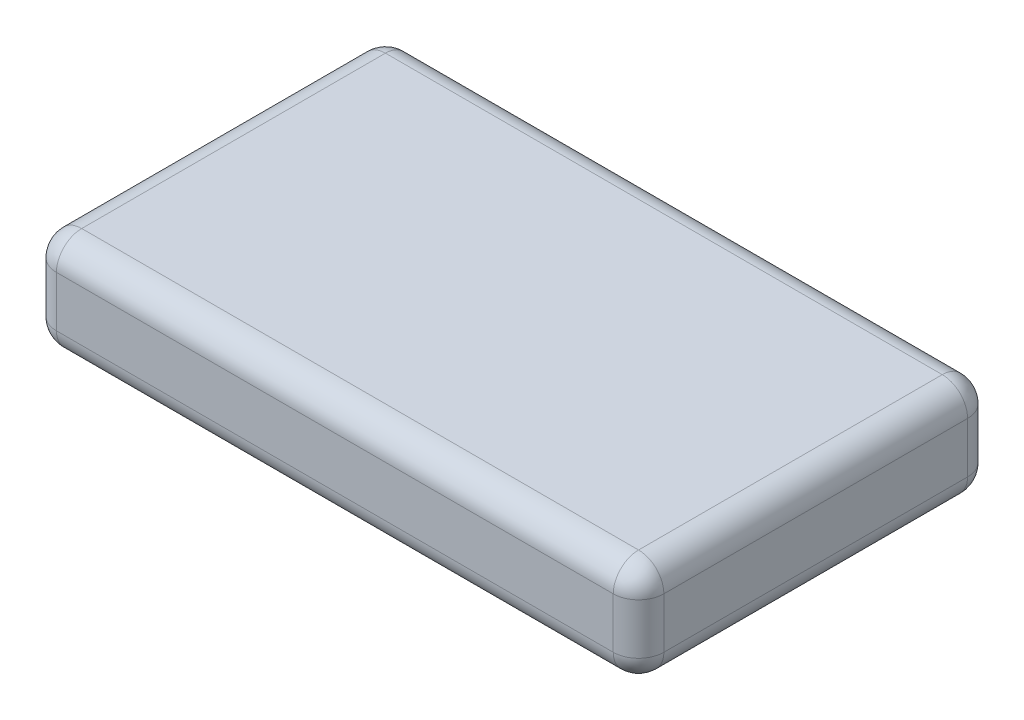
from build123d import *

# Parameters (mm, degrees)
SKETCH1_W           = 609.6
SKETCH1_H           = 355.6
BOSS_EXTRUDE1_DEPTH = 101.6
FILLET1_R           = 25.4


with BuildPart() as part:
    # Sketch1 → Boss-Extrude1 (new body)
    with BuildSketch(Plane(origin=(0, 0, 0), x_dir=(1, 0, 0), z_dir=(0, 1, 0))):
        with Locations((304.8, 177.8)):
            Rectangle(SKETCH1_W, SKETCH1_H)
    extrude(amount=BOSS_EXTRUDE1_DEPTH)

    # Fillet1
    fillet1_edges = [part.edges().sort_by_distance(p)[0] for p in [
        (0, 101.6, -177.8),
        (0, 0, -177.8),
        (0, 50.8, -355.6),
        (304.8, 0, -355.6),
        (304.8, 101.6, -355.6),
        (609.6, 50.8, -355.6),
        (609.6, 0, -177.8),
        (609.6, 101.6, -177.8),
        (609.6, 50.8, 0),
        (0, 50.8, 0),
        (304.8, 0, 0),
        (304.8, 101.6, 0),
    ]]
    fillet(fillet1_edges, radius=FILLET1_R)


solid = part.part
